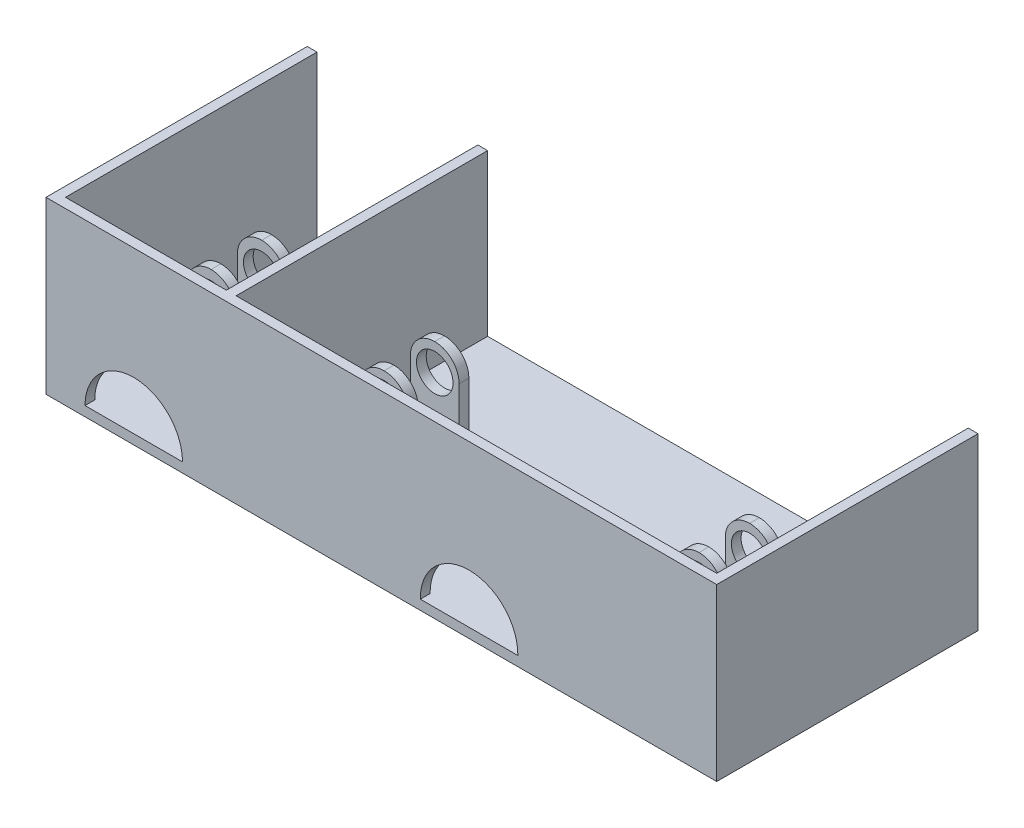
from build123d import *

# Parameters (mm, degrees)
BOSS_EXTRU_1_DEPTH      = 53.6
BOSS_EXTRU_1_DEPTH_BACK = 0.0001
ESQUISSE1_W             = 102.6
ESQUISSE1_H             = 35
ESQUISSE4_W             = 98.6
ESQUISSE4_H             = 51.6
ENL_V_MAT_EXTRU_2_DEPTH = 33
ESQUISSE9_W             = 10
ESQUISSE9_H             = 2
BOSS_EXTRU_3_DEPTH      = 21.5
CONG_2_R                = 5
ESQUISSE10_R            = 3.75
ENL_V_MAT_EXTRU_4_DEPTH = 15
ESQUISSE16_W            = 53.6001
ESQUISSE16_H            = 35
BOSS_EXTRU_5_DEPTH      = 35
ENL_V_MAT_EXTRU_5_DEPTH = 2.1
ESQUISSE19_W            = 33
ESQUISSE19_H            = 51.6001
ENL_V_MAT_EXTRU_6_DEPTH = 33
ENL_V_MAT_EXTRU_7_DEPTH = 2.5
ESQUISSE21_W            = 10
ESQUISSE21_H            = 2
BOSS_EXTRU_6_DEPTH      = 21.75
CONG_3_R                = 5
ESQUISSE22_R            = 3.75
ENL_V_MAT_EXTRU_8_DEPTH = 15


with BuildPart() as part:
    # Esquisse1 → Boss.-Extru.1 (new, two sides: drawn at the far end of the back side and taken through both)
    with BuildSketch(Plane.XY.offset(-BOSS_EXTRU_1_DEPTH_BACK)):
        with Locations((33.832170394, 1.686746988)):
            Rectangle(ESQUISSE1_W, ESQUISSE1_H)
    extrude(amount=BOSS_EXTRU_1_DEPTH + BOSS_EXTRU_1_DEPTH_BACK)

    # Esquisse4 → Enlèv. mat.-Extru.2 (cut)
    with BuildSketch(Plane(origin=(0, 19.186746988, 0), x_dir=(1, 0, 0), z_dir=(0, 1, 0))):
        with Locations((33.832170394, -25.7999)):
            Rectangle(ESQUISSE4_W, ESQUISSE4_H)
    extrude(amount=-ENL_V_MAT_EXTRU_2_DEPTH, mode=Mode.SUBTRACT)

    # Esquisse9 → Boss.-Extru.3 (add)
    with BuildSketch(Plane(origin=(0, -13.813253012, 0), x_dir=(1, 0, 0), z_dir=(0, 1, 0))):
        with Locations((1.532170394, -26.8499)):
            Rectangle(ESQUISSE9_W, ESQUISSE9_H)
        with Locations((1.532170394, -37.2299)):
            Rectangle(ESQUISSE9_W, ESQUISSE9_H)
        with Locations((66.132170394, -26.8499)):
            Rectangle(ESQUISSE9_W, ESQUISSE9_H)
        with Locations((66.132170394, -37.2299)):
            Rectangle(ESQUISSE9_W, ESQUISSE9_H)
    extrude(amount=BOSS_EXTRU_3_DEPTH)

    # Congé2
    cong_2_edges = [part.edges().sort_by_distance(p)[0] for p in [
        (71.132170394, 7.686746988, 37.2299),
        (61.132170394, 7.686746988, 37.2299),
        (71.132170394, 7.686746988, 26.8499),
        (61.132170394, 7.686746988, 26.8499),
        (-3.467829606, 7.686746988, 37.2299),
        (6.532170394, 7.686746988, 37.2299),
        (-3.467829606, 7.686746988, 26.8499),
        (6.532170394, 7.686746988, 26.8499),
    ]]
    fillet(cong_2_edges, radius=CONG_2_R - 0.0001)  # a hair under: the kernel refuses the full size

    # Esquisse10 → Enlèv. mat.-Extru.4 (cut)
    with BuildSketch(Plane(origin=(0, 0, 25.8499), x_dir=(-1, 0, 0), z_dir=(0, 0, -1))):
        with Locations((-66.132170394, 2.186746988)):
            Circle(ESQUISSE10_R)
        with Locations((-1.532170394, 2.186746988)):
            Circle(ESQUISSE10_R)
    extrude(amount=-ENL_V_MAT_EXTRU_4_DEPTH, mode=Mode.SUBTRACT)

    # Esquisse16 → Boss.-Extru.5 (add)
    with BuildSketch(Plane.ZY.offset(17.467829606)):
        with Locations((26.79995, 1.686746988)):
            Rectangle(ESQUISSE16_W, ESQUISSE16_H)
    extrude(amount=BOSS_EXTRU_5_DEPTH)

    # Esquisse18 → Enlèv. mat.-Extru.5 (cut)
    with BuildSketch(Plane.XY.offset(53.6)):
        with BuildLine():
            Line((24.333519225, -13.813253012), (44.330821563, -13.813253012))
            ThreePointArc((44.330821563, -13.813253012), (34.332170394, -3.643205178), (24.333519225, -13.813253012))
        make_face()
    extrude(amount=-ENL_V_MAT_EXTRU_5_DEPTH, mode=Mode.SUBTRACT)

    # Esquisse19 → Enlèv. mat.-Extru.6 (cut)
    with BuildSketch(Plane(origin=(0, 19.186746988, 0), x_dir=(1, 0, 0), z_dir=(0, 1, 0))):
        with Locations((-33.967829606, -25.79995)):
            Rectangle(ESQUISSE19_W, ESQUISSE19_H)
    extrude(amount=-ENL_V_MAT_EXTRU_6_DEPTH, mode=Mode.SUBTRACT)

    # Esquisse20 → Enlèv. mat.-Extru.7 (cut)
    with BuildSketch(Plane.XY.offset(53.6)):
        with BuildLine():
            Line((-24.467829606, -13.813253012), (-44.467829606, -13.813253012))
            ThreePointArc((-44.467829606, -13.813253012), (-34.467829606, -3.813253012), (-24.467829606, -13.813253012))
        make_face()
    extrude(amount=-ENL_V_MAT_EXTRU_7_DEPTH, mode=Mode.SUBTRACT)

    # Esquisse21 → Boss.-Extru.6 (add)
    with BuildSketch(Plane(origin=(0, -13.813253012, 0), x_dir=(1, 0, 0), z_dir=(0, 1, 0))):
        with Locations((-33.967829606, -26.8499)):
            Rectangle(ESQUISSE21_W, ESQUISSE21_H)
        with Locations((-33.967829606, -37.2299)):
            Rectangle(ESQUISSE21_W, ESQUISSE21_H)
    extrude(amount=BOSS_EXTRU_6_DEPTH)

    # Congé3
    cong_3_edges = [part.edges().sort_by_distance(p)[0] for p in [
        (-28.967829606, 7.936746988, 37.2299),
        (-38.967829606, 7.936746988, 37.2299),
        (-38.967829606, 7.936746988, 26.8499),
        (-28.967829606, 7.936746988, 26.8499),
    ]]
    fillet(cong_3_edges, radius=CONG_3_R - 0.0001)  # a hair under: the kernel refuses the full size

    # Esquisse22 → Enlèv. mat.-Extru.8 (cut)
    with BuildSketch(Plane(origin=(0, 0, 25.8499), x_dir=(-1, 0, 0), z_dir=(0, 0, -1))):
        with Locations((33.967829606, 2.186746988)):
            Circle(ESQUISSE22_R)
    extrude(amount=-ENL_V_MAT_EXTRU_8_DEPTH, mode=Mode.SUBTRACT)


solid = part.part
